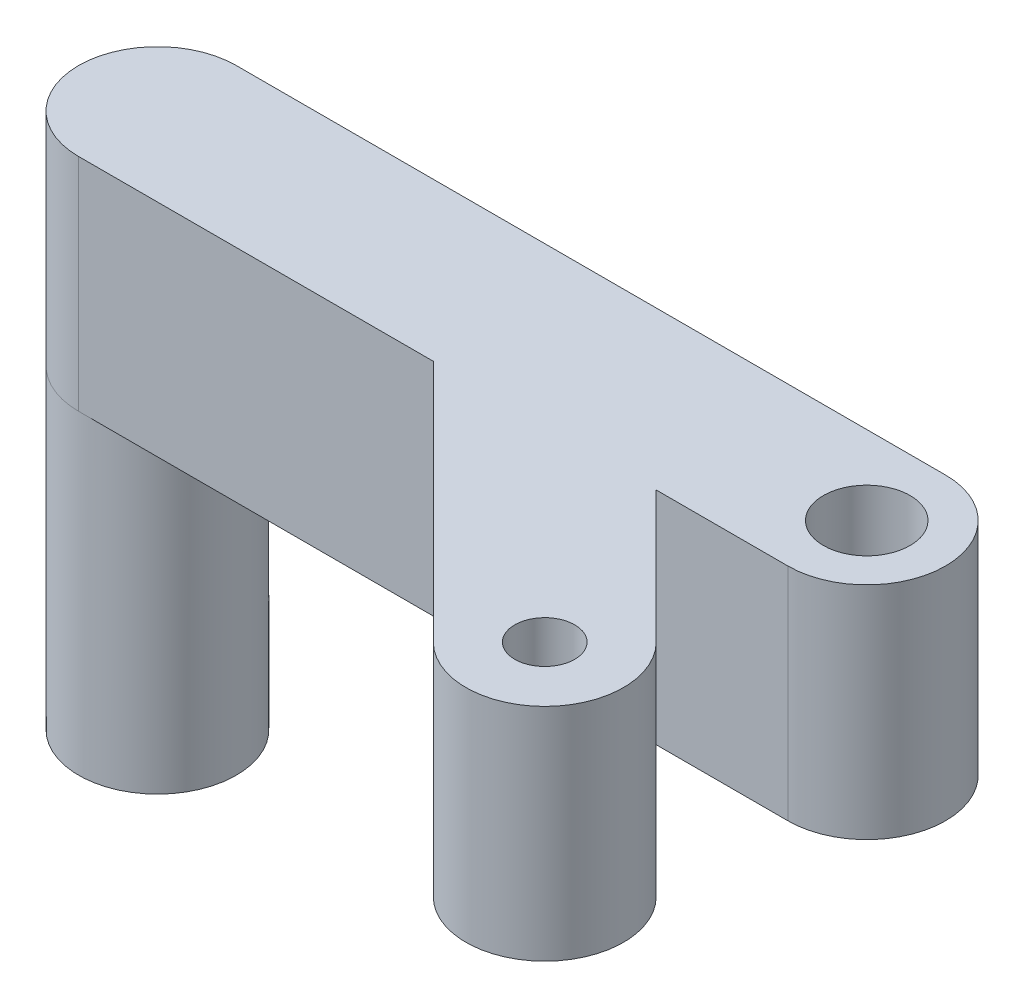
from build123d import *

# Parameters (mm, degrees)
SKETCH1_R           = 5
SKETCH1_R_2         = 2.75
BOSS_EXTRUDE1_DEPTH = 14
BOSS_EXTRUDE2_START = -14
BOSS_EXTRUDE2_DEPTH = 14
SKETCH3_R           = 5
BOSS_EXTRUDE3_DEPTH = 20
FILLET2_R           = 5
BOSS_EXTRUDE4_DEPTH = 14
SKETCH5_R           = 1.9
CUT_EXTRUDE1_DEPTH  = 65.306460705


with BuildPart() as part:
    # Sketch1 → Boss-Extrude1 (new body)
    with BuildSketch(Plane(origin=(0, 0, 0), x_dir=(1, 0, 0), z_dir=(0, 1, 0))):
        with Locations(Location((0, 0, 0), (0, 0, 270))):
            Circle(SKETCH1_R)
        with Locations(Location((0, 0, 0), (0, 0, 270))):
            Circle(SKETCH1_R_2, mode=Mode.SUBTRACT)
    extrude(amount=BOSS_EXTRUDE1_DEPTH)

    # Sketch2 → Boss-Extrude2 (add)
    with BuildSketch(Plane(origin=(0, 14, 0), x_dir=(1, 0, 0), z_dir=(0, 1, 0)).offset(BOSS_EXTRUDE2_START)):
        with BuildLine():
            Line((0, 5), (-50, 5))
            Line((-50, 5), (-50, -5))
            Line((-50, -5), (0, -5))
            ThreePointArc((0, -5), (-5, 0), (0, 5))
        make_face()
    extrude(amount=BOSS_EXTRUDE2_DEPTH)

    # Sketch3 → Boss-Extrude3 (add)
    with BuildSketch(Plane.XZ):
        with Locations(Location((-45, 0, 0), (0, 0, 270))):
            Circle(SKETCH3_R)
    extrude(amount=BOSS_EXTRUDE3_DEPTH)

    # Fillet2
    fillet2_edges = [part.edges().sort_by_distance(p)[0] for p in [
        (-50, 7, -5),
        (-50, 7, 5),
    ]]
    fillet(fillet2_edges, radius=FILLET2_R - 0.0001)  # a hair under: the kernel refuses the full size

    # Sketch4 → Boss-Extrude4 (add)
    with BuildSketch(Plane(origin=(0, 14, 0), x_dir=(1, 0, 0), z_dir=(0, 1, 0))):
        with BuildLine():
            Line((-8.357864376, -5), (0, -13.357864376))
            ThreePointArc((0, -13.357864376), (0, -20.428932188), (-7.071067812, -20.428932188))
            Line((-7.071067812, -20.428932188), (-22.5, -5))
            Line((-22.5, -5), (-8.357864376, -5))
        make_face()
    extrude(amount=-BOSS_EXTRUDE4_DEPTH)

    # Sketch5 → Cut-Extrude1 (cut, through all)
    with BuildSketch(Plane(origin=(0, 14, 0), x_dir=(1, 0, 0), z_dir=(0, 1, 0))):
        with Locations(Location((-3.535533906, -16.893398282, 0), (0, 0, 270))):
            Circle(SKETCH5_R)
    extrude(amount=-CUT_EXTRUDE1_DEPTH, mode=Mode.SUBTRACT)


solid = part.part
